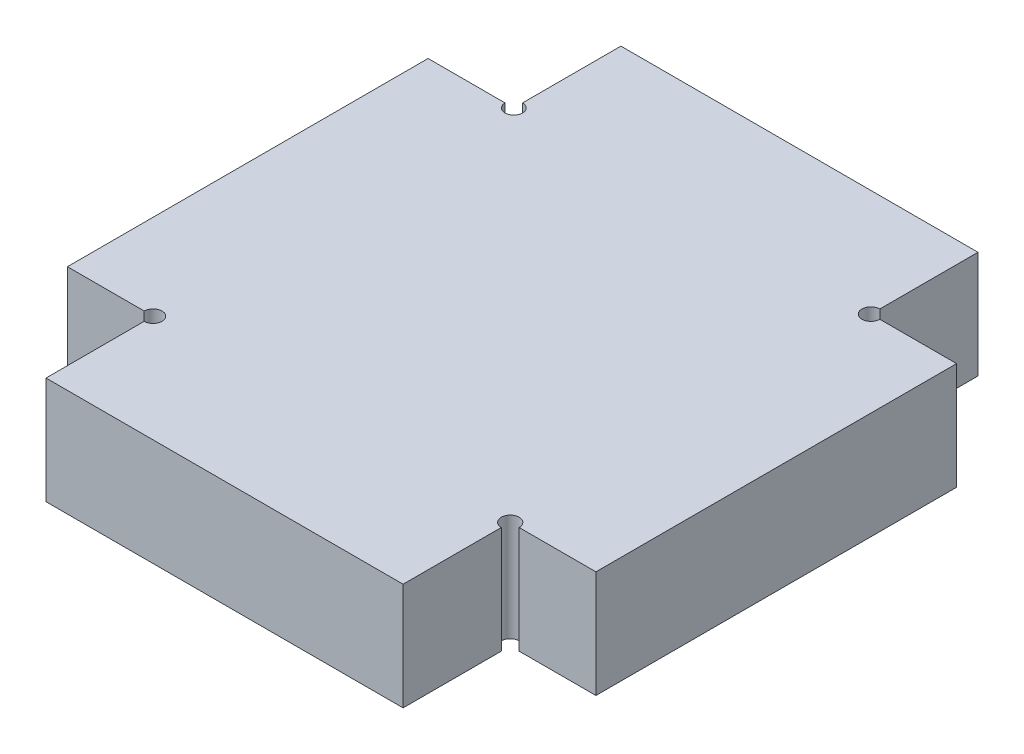
from build123d import *

# Parameters (mm, degrees)
BOSS_EXTRUDE1_DEPTH = 3


with BuildPart() as part:
    # Sketch1 → Boss-Extrude1 (new body)
    with BuildSketch(Plane(origin=(0, 0, 0), x_dir=(1, 0, 0), z_dir=(0, 1, 0))):
        with BuildLine():
            Line((0.25, 5.332122905), (2.4, 5.332122905))
            Line((2.4, 5.332122905), (2.4, -4.767877095))
            Line((2.4, -4.767877095), (0.25, -4.767877095))
            ThreePointArc((0.25, -4.767877095), (-0.176776695, -4.5911004), (0, -5.017877095))
            Line((0, -5.017877095), (0, -7.767877095))
            Line((0, -7.767877095), (-10, -7.767877095))
            Line((-10, -7.767877095), (-10, -5.017877095))
            ThreePointArc((-10, -5.017877095), (-9.823223305, -4.5911004), (-10.25, -4.767877095))
            Line((-10.25, -4.767877095), (-12.4, -4.767877095))
            Line((-12.4, -4.767877095), (-12.4, 5.332122905))
            Line((-12.4, 5.332122905), (-10.245259273, 5.332122905))
            ThreePointArc((-10.245259273, 5.332122905), (-9.826575505, 5.15869841), (-10, 5.577382178))
            Line((-10, 5.577382178), (-10, 8.332122905))
            Line((-10, 8.332122905), (0, 8.332122905))
            Line((0, 8.332122905), (0, 5.582122905))
            ThreePointArc((0, 5.582122905), (-0.176776695, 5.15534621), (0.25, 5.332122905))
        make_face()
    extrude(amount=BOSS_EXTRUDE1_DEPTH)


solid = part.part
